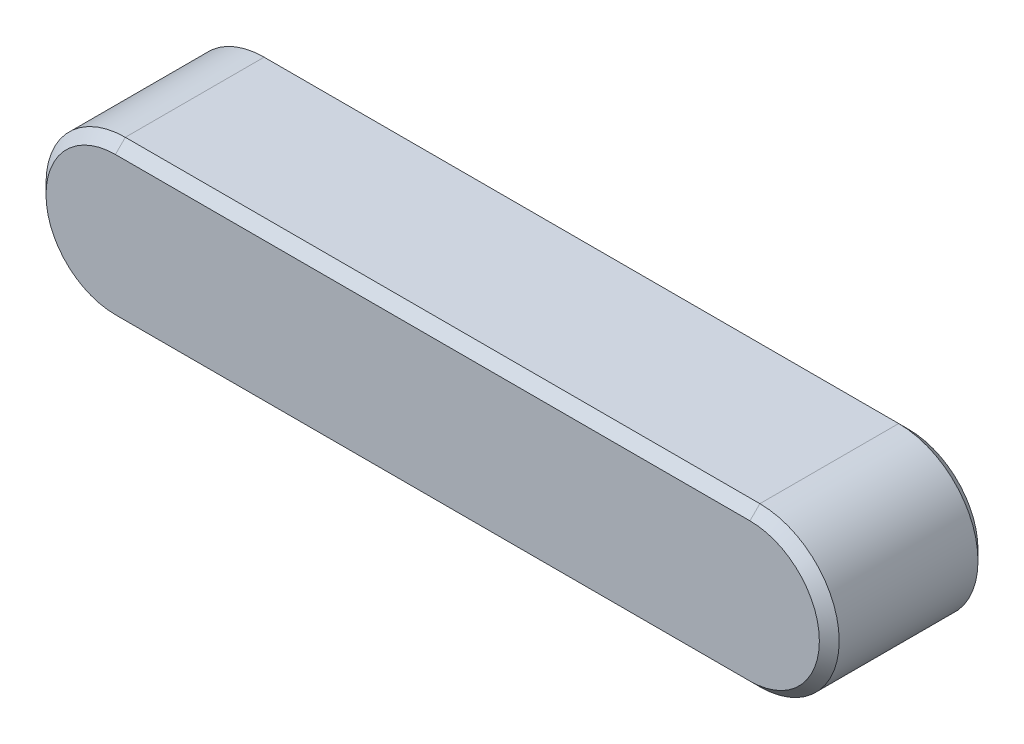
from build123d import *

# Parameters (mm, degrees)
BASEKEY_DEPTH = 2
CHAMFER1_SIZE = 0.25


with BuildPart() as part:
    # Sketch1 → BaseKey (new, symmetric)
    with BuildSketch(Plane.XY):
        with BuildLine():
            Line((-16, 2), (0, 2))
            ThreePointArc((0, 2), (2, 0), (0, -2))
            Line((0, -2), (-16, -2))
            ThreePointArc((-16, -2), (-18, 0), (-16, 2))
        make_face()
    extrude(amount=BASEKEY_DEPTH, both=True)

    # Chamfer1
    chamfer1_edges = [part.edges().sort_by_distance(p)[0] for p in [
        (2, 0, -2),
        (-8, -2, -2),
        (-18, 0, -2),
        (-8, 2, -2),
        (-18, 0, 2),
        (-8, -2, 2),
        (2, 0, 2),
        (-8, 2, 2),
    ]]
    chamfer(chamfer1_edges, length=CHAMFER1_SIZE)


solid = part.part
